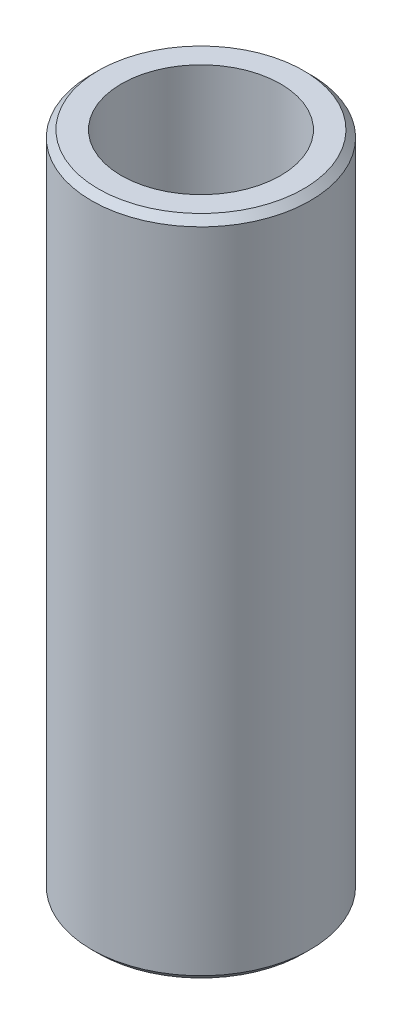
from build123d import *

# Parameters (mm, degrees)
SKETCH1_R           = 47.5
BOSS_EXTRUDE1_DEPTH = 287.57751302
SKETCH2_R           = 34.55727992
CUT_EXTRUDE1_DEPTH  = 296.319024099
CHAMFER1_SIZE       = 2.956637793


with BuildPart() as part:
    # Sketch1 → Boss-Extrude1 (new body)
    with BuildSketch(Plane(origin=(0, 0, 0), x_dir=(1, 0, 0), z_dir=(0, 1, 0))):
        Circle(SKETCH1_R)
    extrude(amount=BOSS_EXTRUDE1_DEPTH)

    # Sketch2 → Cut-Extrude1 (cut, through all)
    with BuildSketch(Plane(origin=(0, 0, 0), x_dir=(1, 0, 0), z_dir=(0, 1, 0))):
        Circle(SKETCH2_R)
    extrude(amount=CUT_EXTRUDE1_DEPTH, mode=Mode.SUBTRACT)

    # Chamfer1
    chamfer1_edges = [part.edges().sort_by_distance(p)[0] for p in [
        (-47.5, 287.57751302, 0),
        (-47.5, 0, 0),
    ]]
    chamfer(chamfer1_edges, length=CHAMFER1_SIZE)


solid = part.part
